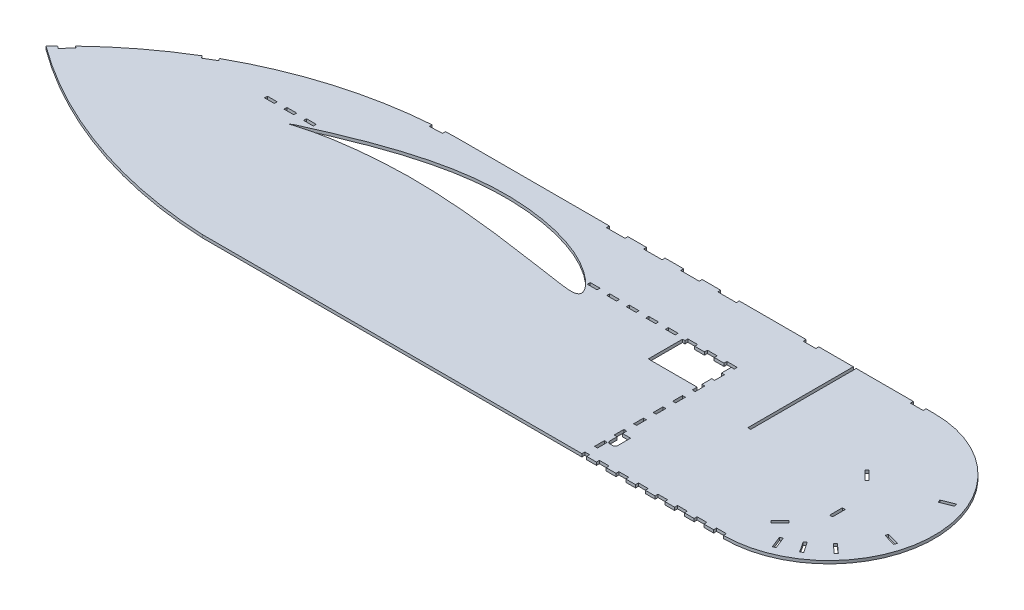
from build123d import *

# Parameters (mm, degrees)
BOSS_EXTRUDE1_DEPTH = 3
SKETCH2_W           = 3
SKETCH2_H           = 13
SKETCH2_W_2         = 13
SKETCH2_H_2         = 3
SKETCH2_W_3         = 19
SKETCH2_W_4         = 10
SKETCH2_H_3         = 10
SKETCH2_W_5         = 4.93
SKETCH2_H_4         = 108
CUT_EXTRUDE1_DEPTH  = 934.342916617


with BuildPart() as part:
    # Sketch1 → Boss-Extrude1 (new body)
    with BuildSketch(Plane(origin=(0, 0, 0), x_dir=(1, 0, 0), z_dir=(0, 1, 0))):
        with BuildLine():
            Line((266.408252791, 0), (800, 0))
            ThreePointArc((800, 0), (908, 108), (800, 216))
            Line((800, 216), (316.294556964, 216))
            ThreePointArc((316.294556964, 216), (154.432198565, 182.326352039), (19.429068043, 86.893169221))
            ThreePointArc((19.429068043, 86.893169221), (136.475600537, 25.133273094), (266.408252791, 0))
        make_face()
    extrude(amount=BOSS_EXTRUDE1_DEPTH)

    # Sketch2 → Cut-Extrude1 (cut, through all)
    with BuildSketch(Plane.XZ):
        Polygon((647.57, -153), (637.57, -153), (637.57, -156), (627.57, -156), (627.57, -153), (617.57, -153), (617.57, -156), (607.57, -156), (607.57, -153), (605.07, -153), (605.07, -118), (655.07, -118), (655.07, -113), (658.07, -113), (658.07, -123), (655.07, -123), (655.07, -133), (658.07, -133), (658.07, -143), (655.07, -143), (655.07, -153), (658.07, -153), (658.07, -156), (647.57, -156), align=None)
        Polygon((823.689305433, -121.232773417), (814.496917278, -130.425161573), (816.618237622, -132.546481916), (825.810625777, -123.354093761), align=None)
        Polygon((833.160643349, -28.10588463), (837.93522035, -16.014424235), (835.144883336, -14.912598774), (830.370306335, -27.004059168), align=None)
        with Locations((837.95655194, -78.816857664)):
            Rectangle(SKETCH2_W, SKETCH2_H)
        with BuildLine():
            Line((658.07, -25.473381029), (658.07, -33))
            Line((658.07, -33), (655.07, -33))
            Line((655.07, -33), (655.07, -43))
            Line((655.07, -43), (658.07, -43))
            Line((658.07, -43), (658.07, -38.673381029))
            Line((658.07, -38.673381029), (666.27, -38.673381029))
            Line((666.27, -38.673381029), (666.27, -25.473381029))
            ThreePointArc((666.27, -25.473381029), (665.537766953, -23.705614076), (663.77, -22.973381029))
            Line((663.77, -22.973381029), (660.57, -22.973381029))
            ThreePointArc((660.57, -22.973381029), (658.802233047, -23.705614076), (658.07, -25.473381029))
        make_face()
        with BuildLine():
            Line((212.57, -142.261782597), (212.57, -142.294782597))
            add(Edge.make_bspline(
                [(212.57, -142.294782597), (212.815137814, -142.460102486), (213.721483955, -143.071338431), (215.664179604, -144.220627165), (218.723437449, -145.777902142), (222.783765044, -147.580430449), (227.75908382, -149.780753256), (233.673151887, -152.372942719), (243.334631626, -156.473964415), (254.071597155, -160.928560196), (265.811315632, -165.551386352), (275.559769605, -169.192616013), (285.820264156, -172.789650289), (300.213165162, -177.442893994), (315.047470761, -181.61442891), (330.216772764, -185.078244178), (341.716798025, -187.262793988), (353.238408154, -188.970546018), (364.74982071, -190.189827969), (376.222154657, -190.889317525), (387.611451467, -191.086885836), (398.853751386, -190.764655348), (413.421420996, -189.696341642), (427.580802498, -187.700042396), (441.195366572, -184.827458978), (450.821943115, -182.319735681), (459.948918056, -179.469695278), (468.511745548, -176.287644359), (476.453624938, -172.824739179), (483.715148146, -169.128859345), (490.24814377, -165.284833696), (496.019667562, -161.40694583), (500.998027396, -157.585747413), (505.147593549, -153.884087589), (508.447339472, -150.382728864), (510.852240131, -147.180842115), (512.23052565, -144.518995071), (512.672376723, -142.438033672), (512.365957104, -140.693980261), (510.836297954, -139.267947677), (508.300825673, -138.604557497), (504.990749494, -138.396901122), (500.845143819, -138.632879923), (495.886387834, -139.207005807), (490.127383335, -140.033765729), (483.600688534, -141.01415409), (476.345974836, -142.081971784), (468.41886468, -143.270863791), (459.86962452, -144.552957933), (447.40415706, -146.414008038), (434.302787697, -148.29198326), (413.230560269, -151.080307043), (394.916461571, -153.170522792), (372.413070638, -155.185169178), (353.278576878, -156.497400442), (334.10390548, -157.12050793), (318.83753012, -157.119300437), (307.569298967, -156.863067348), (296.54483902, -156.342386113), (285.853643217, -155.59861473), (275.586288909, -154.654588864), (265.829573747, -153.556930461), (256.673464041, -152.312824912), (248.205041684, -150.95854436), (240.510067524, -149.523302558), (233.666056009, -148.064077742), (227.735558734, -146.629571507), (222.771530443, -145.20558608), (218.774640723, -143.912633605), (215.724793866, -142.995242016), (213.753356987, -142.496728121), (212.816237246, -142.310670921), (212.57, -142.261782597)],
                knots=[0, 0, 0, 0, 0.001413477, 0.005226038, 0.010781091, 0.017815608, 0.026460951, 0.036790889, 0.048685593, 0.076639155, 0.092362872, 0.109003461, 0.126386903, 0.144339126, 0.181312719, 0.200023431, 0.218712626, 0.237261299, 0.255692478, 0.274037197, 0.292192583, 0.310132767, 0.327788163, 0.362001934, 0.378421226, 0.394286639, 0.40954344, 0.424114253, 0.43793778, 0.450941833, 0.463044023, 0.474154417, 0.484164575, 0.493023962, 0.500713088, 0.507125739, 0.512129705, 0.514904185, 0.517171427, 0.520261618, 0.5242453, 0.529497961, 0.536092185, 0.54406114, 0.553363127, 0.563904543, 0.575614949, 0.588420092, 0.60222661, 0.616944448, 0.648675826, 0.665501113, 0.718564132, 0.736789145, 0.773513212, 0.810244924, 0.828488569, 0.846493195, 0.864125178, 0.88124851, 0.897725282, 0.913415058, 0.928184346, 0.941897285, 0.954411455, 0.965602702, 0.975349728, 0.983575522, 0.990284579, 0.99543259, 0.998799869, 1, 1, 1, 1], degree=3))
        make_face()
        Polygon((879.488683308, -142.121066281), (891.521725575, -147.041014838), (892.657098319, -144.26415893), (880.624056052, -139.344210373), align=None)
        Polygon((883.5475205, -85.58327061), (896.043113277, -81.997163924), (895.215550195, -79.113565591), (882.719957419, -82.699672277), align=None)
        Polygon((865.360730479, -51.33720048), (875.034295558, -42.652608454), (873.030158937, -40.420247282), (863.356593858, -49.104839308), align=None)
        Polygon((849.064781802, -36.758543495), (856.251694152, -25.925801881), (853.751830703, -24.267283646), (846.564918353, -35.10002526), align=None)
        Polygon((822.408918344, -44.734564455), (813.216530188, -35.542176299), (811.095209845, -37.663496643), (820.287598, -46.855884798), align=None)
        with Locations((785, -214.5)):
            Rectangle(SKETCH2_W_2, SKETCH2_H_2)
        with Locations((675.107627624, -214.5)):
            Rectangle(SKETCH2_W_2, SKETCH2_H_2)
        with Locations((590.701810534, -214.5)):
            Rectangle(SKETCH2_W_3, SKETCH2_H_2)
        with Locations((552.701810534, -214.5)):
            Rectangle(SKETCH2_W_3, SKETCH2_H_2)
        with Locations((514.701810534, -214.5)):
            Rectangle(SKETCH2_W_3, SKETCH2_H_2)
        with Locations((476.701810534, -214.5)):
            Rectangle(SKETCH2_W_3, SKETCH2_H_2)
        Polygon((286.653605669, -215.067910052), (299.639993398, -215.662665262), (299.777244601, -212.665806556), (286.790856872, -212.071051345), align=None)
        Polygon((107.891846949, -158.40758228), (119.051202256, -165.076074548), (120.590085087, -162.500838708), (109.43072978, -155.83234644), align=None)
        Polygon((25.225136805, -93.110530953), (34.089712558, -102.619437132), (36.284075522, -100.573765804), (27.419499769, -91.064859625), align=None)
        with Locations((532.57, -154.5)):
            Rectangle(SKETCH2_W_4, SKETCH2_H_2)
        with Locations((552.57, -154.5)):
            Rectangle(SKETCH2_W_4, SKETCH2_H_2)
        with Locations((572.57, -154.5)):
            Rectangle(SKETCH2_W_4, SKETCH2_H_2)
        with Locations((592.57, -154.5)):
            Rectangle(SKETCH2_W_4, SKETCH2_H_2)
        with Locations((656.57, -98)):
            Rectangle(SKETCH2_W, SKETCH2_H_3)
        with Locations((656.57, -78)):
            Rectangle(SKETCH2_W, SKETCH2_H_3)
        with Locations((656.57, -58)):
            Rectangle(SKETCH2_W, SKETCH2_H_3)
        with Locations((656.57, -18)):
            Rectangle(SKETCH2_W, SKETCH2_H_3)
        with Locations((657.535, -1.5)):
            Rectangle(SKETCH2_W_5, SKETCH2_H_2)
        with Locations((675, -1.5)):
            Rectangle(SKETCH2_W_4, SKETCH2_H_2)
        with Locations((695, -1.5)):
            Rectangle(SKETCH2_W_4, SKETCH2_H_2)
        with Locations((715, -1.5)):
            Rectangle(SKETCH2_W_4, SKETCH2_H_2)
        with Locations((735, -1.5)):
            Rectangle(SKETCH2_W_4, SKETCH2_H_2)
        with Locations((755, -1.5)):
            Rectangle(SKETCH2_W_4, SKETCH2_H_2)
        with Locations((775, -1.5)):
            Rectangle(SKETCH2_W_4, SKETCH2_H_2)
        with Locations((795, -1.5)):
            Rectangle(SKETCH2_W_4, SKETCH2_H_2)
        with Locations((182.07, -154.5)):
            Rectangle(SKETCH2_W_4, SKETCH2_H_2)
        with Locations((202.07, -154.5)):
            Rectangle(SKETCH2_W_4, SKETCH2_H_2)
        with Locations((222.07, -154.5)):
            Rectangle(SKETCH2_W_4, SKETCH2_H_2)
        with Locations((512.57, -154.5)):
            Rectangle(SKETCH2_W_4, SKETCH2_H_2)
        with Locations((718.5, -162)):
            Rectangle(SKETCH2_W, SKETCH2_H_4)
    extrude(amount=-CUT_EXTRUDE1_DEPTH, mode=Mode.SUBTRACT)


solid = part.part
